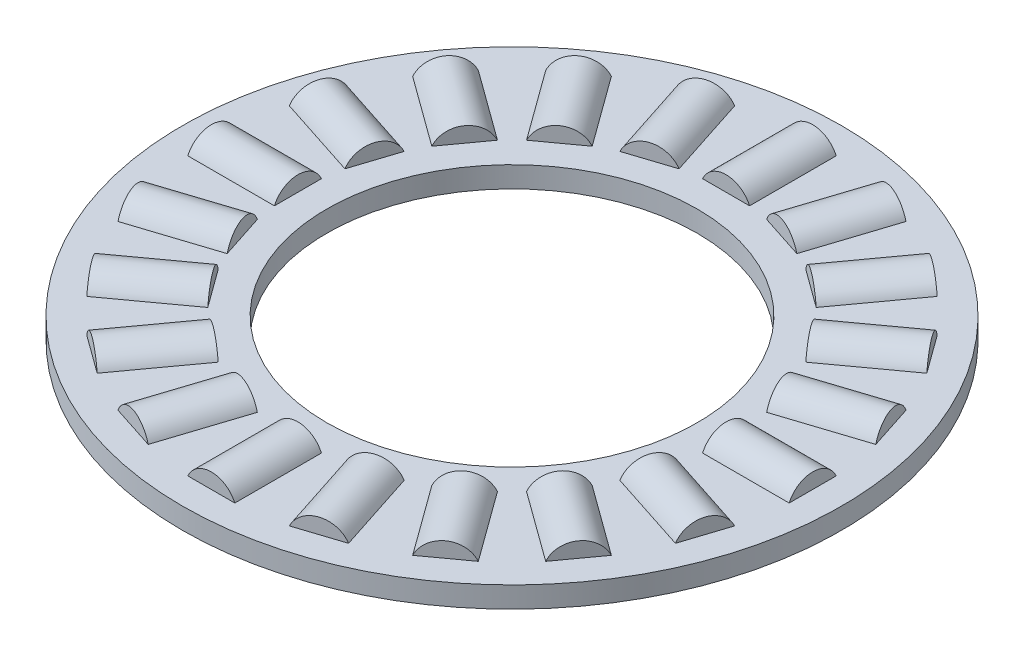
from build123d import *

# Parameters (mm, degrees)
SKETCH5_W         = 5.5626
SKETCH5_H         = 0.81
SKETCH3_W         = 3.33756
SKETCH3_H         = 0.9921875
SKETCH2_W         = 3.33756
SKETCH2_H         = 0.9921875
CIRPATTERN1_COUNT = 20
CIRPATTERN1_ANGLE = 342
CIRPATTERN2_COUNT = 20


with BuildPart() as part:
    # Sketch5 → Revolve3 (revolve)
    with BuildSketch(Plane(origin=(0, 0, 0), x_dir=(0, 0, -1), z_dir=(1, 0, 0))):
        with Locations((-9.9187, 0)):
            Rectangle(SKETCH5_W, SKETCH5_H)
    revolve(axis=Axis((0, -0.9921875, 0), (0, 1, 0)))

    # Sketch3 → Cut-Revolve1 (revolve, cut)
    with BuildSketch(Plane(origin=(0, 0, 0), x_dir=(0, 0, -1), z_dir=(1, 0, 0))):
        with Locations((-9.9187, 0.49609375)):
            Rectangle(SKETCH3_W, SKETCH3_H)
    cut_revolve1 = revolve(axis=Axis((0, 0, 11.58748), (0, 0, -1)), mode=Mode.SUBTRACT)

    # CirPattern2: Cut-Revolve1 ×20 about axis
    cirpattern2_axis = Axis((0, 0.9921875, 0), (0, -1, 0))
    for i in range(1, CIRPATTERN2_COUNT):
        add(cut_revolve1.rotate(cirpattern2_axis, i * 360 / CIRPATTERN2_COUNT), mode=Mode.SUBTRACT)


with BuildPart() as body_2:
    # Sketch2 → Revolve2 (revolve)
    with BuildSketch(Plane(origin=(0, 0, 0), x_dir=(0, 0, -1), z_dir=(1, 0, 0))):
        with Locations((-9.9187, 0.49609375)):
            Rectangle(SKETCH2_W, SKETCH2_H)
    revolve(axis=Axis((0, 0, 11.58748), (0, 0, -1)))


with BuildPart() as cirpattern1_1:
    # CirPattern1: pattern copy
    add(body_2.part.rotate(Axis((0, 0.9921875, 0), (0, -1, 0)), 1 * CIRPATTERN1_ANGLE / (CIRPATTERN1_COUNT - 1)))


with BuildPart() as cirpattern1_2:
    # CirPattern1: pattern copy
    add(body_2.part.rotate(Axis((0, 0.9921875, 0), (0, -1, 0)), 2 * CIRPATTERN1_ANGLE / (CIRPATTERN1_COUNT - 1)))


with BuildPart() as cirpattern1_3:
    # CirPattern1: pattern copy
    add(body_2.part.rotate(Axis((0, 0.9921875, 0), (0, -1, 0)), 3 * CIRPATTERN1_ANGLE / (CIRPATTERN1_COUNT - 1)))


with BuildPart() as cirpattern1_4:
    # CirPattern1: pattern copy
    add(body_2.part.rotate(Axis((0, 0.9921875, 0), (0, -1, 0)), 4 * CIRPATTERN1_ANGLE / (CIRPATTERN1_COUNT - 1)))


with BuildPart() as cirpattern1_5:
    # CirPattern1: pattern copy
    add(body_2.part.rotate(Axis((0, 0.9921875, 0), (0, -1, 0)), 5 * CIRPATTERN1_ANGLE / (CIRPATTERN1_COUNT - 1)))


with BuildPart() as cirpattern1_6:
    # CirPattern1: pattern copy
    add(body_2.part.rotate(Axis((0, 0.9921875, 0), (0, -1, 0)), 6 * CIRPATTERN1_ANGLE / (CIRPATTERN1_COUNT - 1)))


with BuildPart() as cirpattern1_7:
    # CirPattern1: pattern copy
    add(body_2.part.rotate(Axis((0, 0.9921875, 0), (0, -1, 0)), 7 * CIRPATTERN1_ANGLE / (CIRPATTERN1_COUNT - 1)))


with BuildPart() as cirpattern1_8:
    # CirPattern1: pattern copy
    add(body_2.part.rotate(Axis((0, 0.9921875, 0), (0, -1, 0)), 8 * CIRPATTERN1_ANGLE / (CIRPATTERN1_COUNT - 1)))


with BuildPart() as cirpattern1_9:
    # CirPattern1: pattern copy
    add(body_2.part.rotate(Axis((0, 0.9921875, 0), (0, -1, 0)), 9 * CIRPATTERN1_ANGLE / (CIRPATTERN1_COUNT - 1)))


with BuildPart() as cirpattern1_10:
    # CirPattern1: pattern copy
    add(body_2.part.rotate(Axis((0, 0.9921875, 0), (0, -1, 0)), 10 * CIRPATTERN1_ANGLE / (CIRPATTERN1_COUNT - 1)))


with BuildPart() as cirpattern1_11:
    # CirPattern1: pattern copy
    add(body_2.part.rotate(Axis((0, 0.9921875, 0), (0, -1, 0)), 11 * CIRPATTERN1_ANGLE / (CIRPATTERN1_COUNT - 1)))


with BuildPart() as cirpattern1_12:
    # CirPattern1: pattern copy
    add(body_2.part.rotate(Axis((0, 0.9921875, 0), (0, -1, 0)), 12 * CIRPATTERN1_ANGLE / (CIRPATTERN1_COUNT - 1)))


with BuildPart() as cirpattern1_13:
    # CirPattern1: pattern copy
    add(body_2.part.rotate(Axis((0, 0.9921875, 0), (0, -1, 0)), 13 * CIRPATTERN1_ANGLE / (CIRPATTERN1_COUNT - 1)))


with BuildPart() as cirpattern1_14:
    # CirPattern1: pattern copy
    add(body_2.part.rotate(Axis((0, 0.9921875, 0), (0, -1, 0)), 14 * CIRPATTERN1_ANGLE / (CIRPATTERN1_COUNT - 1)))


with BuildPart() as cirpattern1_15:
    # CirPattern1: pattern copy
    add(body_2.part.rotate(Axis((0, 0.9921875, 0), (0, -1, 0)), 15 * CIRPATTERN1_ANGLE / (CIRPATTERN1_COUNT - 1)))


with BuildPart() as cirpattern1_16:
    # CirPattern1: pattern copy
    add(body_2.part.rotate(Axis((0, 0.9921875, 0), (0, -1, 0)), 16 * CIRPATTERN1_ANGLE / (CIRPATTERN1_COUNT - 1)))


with BuildPart() as cirpattern1_17:
    # CirPattern1: pattern copy
    add(body_2.part.rotate(Axis((0, 0.9921875, 0), (0, -1, 0)), 17 * CIRPATTERN1_ANGLE / (CIRPATTERN1_COUNT - 1)))


with BuildPart() as cirpattern1_18:
    # CirPattern1: pattern copy
    add(body_2.part.rotate(Axis((0, 0.9921875, 0), (0, -1, 0)), 18 * CIRPATTERN1_ANGLE / (CIRPATTERN1_COUNT - 1)))


with BuildPart() as cirpattern1_19:
    # CirPattern1: pattern copy
    add(body_2.part.rotate(Axis((0, 0.9921875, 0), (0, -1, 0)), 19 * CIRPATTERN1_ANGLE / (CIRPATTERN1_COUNT - 1)))


solid = Compound([part.part, body_2.part, cirpattern1_1.part, cirpattern1_2.part, cirpattern1_3.part, cirpattern1_4.part, cirpattern1_5.part, cirpattern1_6.part, cirpattern1_7.part, cirpattern1_8.part, cirpattern1_9.part, cirpattern1_10.part, cirpattern1_11.part, cirpattern1_12.part, cirpattern1_13.part, cirpattern1_14.part, cirpattern1_15.part, cirpattern1_16.part, cirpattern1_17.part, cirpattern1_18.part, cirpattern1_19.part])
